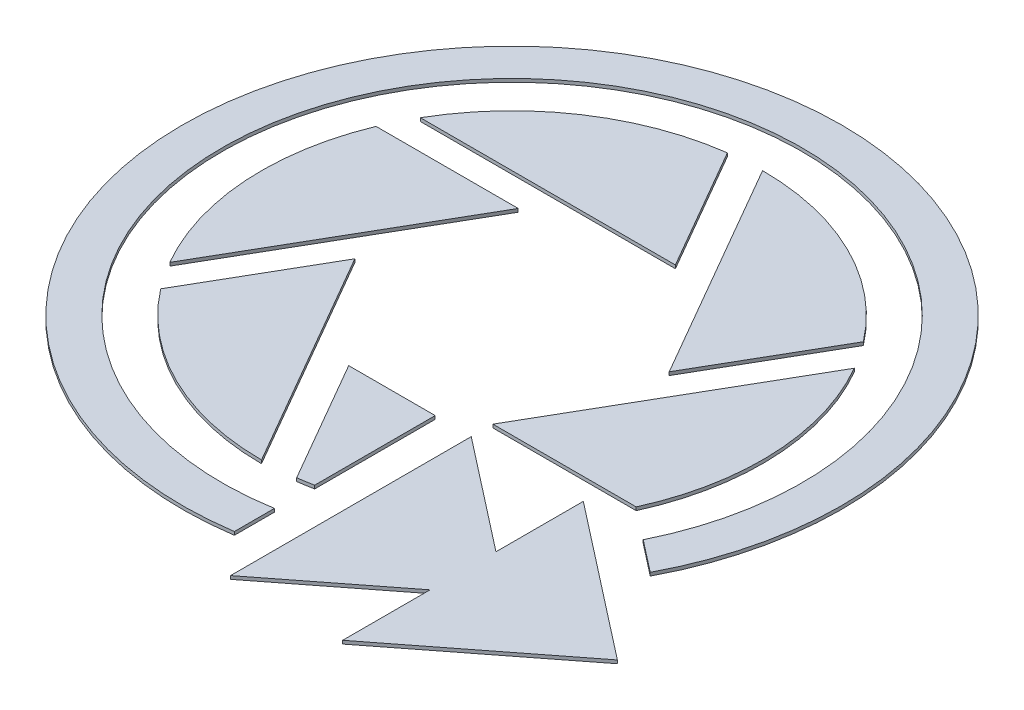
from build123d import *

# Parameters (mm, degrees)
EXTRUDE_1_DEPTH   = 5
EXTRUDE_1_2_DEPTH = 5
EXTRUDE_1_3_DEPTH = 5
EXTRUDE_1_4_DEPTH = 5
EXTRUDE_1_5_DEPTH = 5
EXTRUDE_1_6_DEPTH = 5
EXTRUDE_1_7_DEPTH = 5
EXTRUDE_1_8_DEPTH = 5


with BuildPart() as part:
    # 草图1 → 凸台-拉伸1 (new body)
    with BuildSketch(Plane(origin=(0, 0, 0), x_dir=(1, 0, 0), z_dir=(0, 1, 0))):
        with BuildLine():
            Line((-109.696551146, 190), (-329.089653438, 190))
            ThreePointArc((-329.089653438, 190), (-211.305466091, 315.832233947), (-50.050204348, 376.68949686))
            Line((-50.050204348, 376.68949686), (57.735026919, 190))
            Line((57.735026919, 190), (-109.696551146, 190))
        make_face()
    extrude(amount=EXTRUDE_1_DEPTH)


with BuildPart() as body_2:
    # 草图1 → Extrude 1 2 (new body)
    with BuildSketch(Plane(origin=(0, 0, 0), x_dir=(1, 0, 0), z_dir=(0, 1, 0))):
        with BuildLine():
            Line((128.449935554, -157.518185391), (219.393102292, 0))
            Line((219.393102292, 0), (329.089653438, 190))
            ThreePointArc((329.089653438, 190), (379.560665165, 18.267497356), (345.815010187, -157.518185391))
            Line((345.815010187, -157.518185391), (128.449935554, -157.518185391))
        make_face()
    extrude(amount=EXTRUDE_1_2_DEPTH)


with BuildPart() as body_3:
    # 草图1 → Extrude 1 3 (new body)
    with BuildSketch(Plane(origin=(0, 0, 0), x_dir=(1, 0, 0), z_dir=(0, 1, 0))):
        with BuildLine():
            Line((193.412340179, 45), (109.696551146, 190))
            Line((109.696551146, 190), (0, 380))
            ThreePointArc((0, 380), (167.866004887, 340.912018567), (301.197571446, 231.68949686))
            Line((301.197571446, 231.68949686), (193.412340179, 45))
        make_face()
    extrude(amount=EXTRUDE_1_3_DEPTH)


with BuildPart() as body_4:
    # 草图1 → Extrude 1 4 (new body)
    with BuildSketch(Plane(origin=(0, 0, 0), x_dir=(1, 0, 0), z_dir=(0, 1, 0))):
        with BuildLine():
            Line((-135.67731326, 145), (-219.393102292, 0))
            Line((-219.393102292, 0), (-329.089653438, -190))
            ThreePointArc((-329.089653438, -190), (-379.171470978, -25.07978462), (-351.247775794, 145))
            Line((-351.247775794, 145), (-135.67731326, 145))
        make_face()
    extrude(amount=EXTRUDE_1_4_DEPTH)


with BuildPart() as body_5:
    # 草图1 → Extrude 1 5 (new body)
    with BuildSketch(Plane(origin=(0, 0, 0), x_dir=(1, 0, 0), z_dir=(0, 1, 0))):
        with BuildLine():
            Line((-193.412340179, -45), (-109.696551146, -190))
            Line((-109.696551146, -190), (0, -380))
            ThreePointArc((0, -380), (-167.866004887, -340.912018567), (-301.197571446, -231.68949686))
            Line((-301.197571446, -231.68949686), (-193.412340179, -45))
        make_face()
    extrude(amount=EXTRUDE_1_5_DEPTH)


with BuildPart() as body_6:
    # 草图1 → Extrude 1 6 (new body)
    with BuildSketch(Plane(origin=(0, 0, 0), x_dir=(1, 0, 0), z_dir=(0, 1, 0))):
        with BuildLine():
            Line((-57.735026919, -190), (73.449935554, -190))
            Line((73.449935554, -190), (73.449935554, -372.83388656))
            ThreePointArc((73.449935554, -372.83388656), (61.780155161, -374.944279098), (50.050204348, -376.68949686))
            Line((50.050204348, -376.68949686), (-57.735026919, -190))
        make_face()
    extrude(amount=EXTRUDE_1_6_DEPTH)


with BuildPart() as body_7:
    # 草图1 → Extrude 1 7 (new body)
    with BuildSketch(Plane(origin=(0, 0, 0), x_dir=(1, 0, 0), z_dir=(0, 1, 0))):
        Polygon((128.449935554, -190.33388656), (128.449935554, -555.33388656), (298.449935554, -422.83388656), (298.449935554, -555.33388656), (532.60087895, -372.83388656), (298.449935554, -190.33388656), (298.449935554, -322.83388656), align=None)
    extrude(amount=EXTRUDE_1_7_DEPTH)


with BuildPart() as body_8:
    # 草图1 → Extrude 1 8 (new body)
    with BuildSketch(Plane(origin=(0, 0, 0), x_dir=(1, 0, 0), z_dir=(0, 1, 0))):
        with BuildLine():
            Line((73.449935554, -433.82612527), (73.449935554, -494.57568376))
            ThreePointArc((73.449935554, -494.57568376), (-289.254482056, 407.838012709), (442.470113798, -232.852310264))
            Line((442.470113798, -232.852310264), (394.283817369, -195.29534393))
            ThreePointArc((394.283817369, -195.29534393), (-262.522283469, 353.103456061), (73.449935554, -433.82612527))
        make_face()
    extrude(amount=EXTRUDE_1_8_DEPTH)


solid = Compound([part.part, body_2.part, body_3.part, body_4.part, body_5.part, body_6.part, body_7.part, body_8.part])
